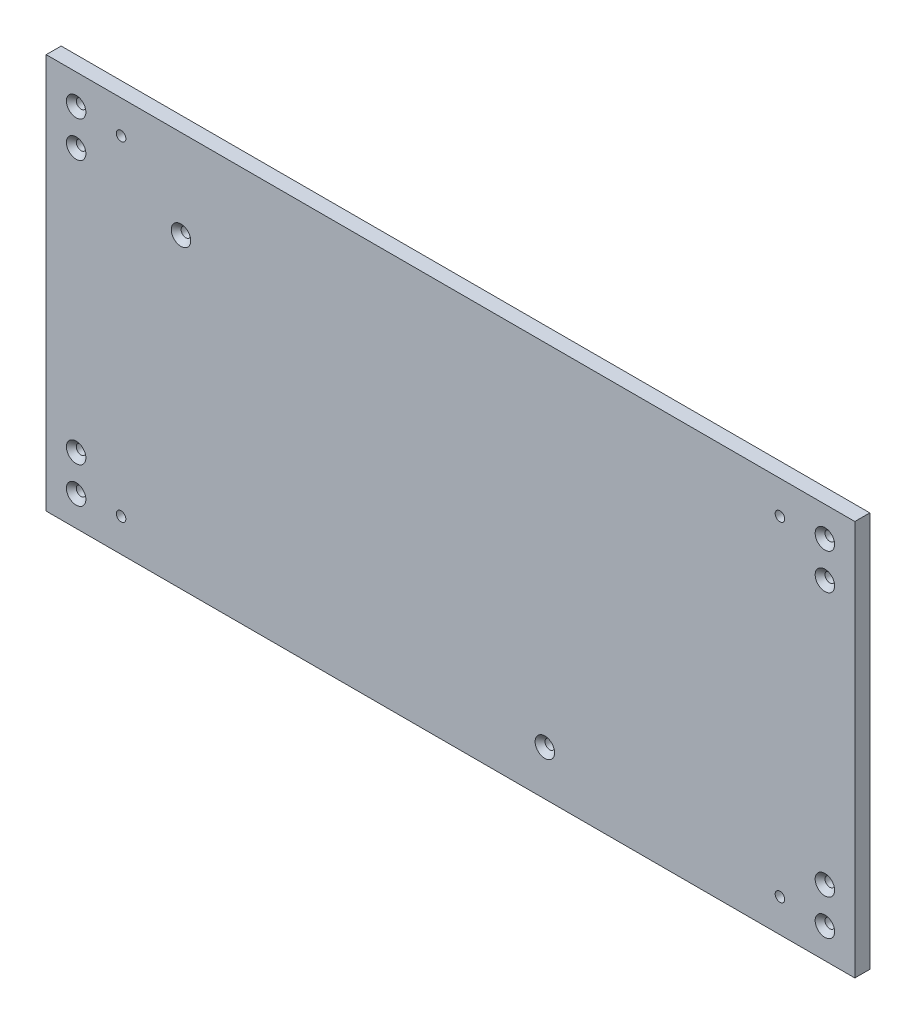
from build123d import *

# Parameters (mm, degrees)
SKETCH1_W                            = 270
SKETCH1_H                            = 132
BASE_DEPTH                           = 2.5
F_3_2_3_2_WALLMOUNTHOLES_D           = 3.2
F_3_2_3_2_WALLMOUNTHOLES_CSINK_D     = 6.5
F_3_2_3_2_WALLMOUNTHOLES_CSINK_ANGLE = 90
F_3_2_3_2_FEETMOUNTHOLES_D           = 3.2
F_3_2_3_2_DIAMETER_HOLE2_D           = 3.2
F_3_2_3_2_DIAMETER_HOLE2_CSINK_D     = 6.5
F_3_2_3_2_DIAMETER_HOLE2_CSINK_ANGLE = 90


with BuildPart() as part:
    # Sketch1 → Base (new, symmetric)
    with BuildSketch(Plane.XY):
        Rectangle(SKETCH1_W, SKETCH1_H)
    extrude(amount=BASE_DEPTH, both=True)

    # Ø3.2 (3.2) WallMountHoles (through all)
    with Locations(Plane.XY.offset(2.5)):
        with Locations((-125, 56), (-125, 44), (-125, -44), (-125, -56), (125, -56), (125, -44), (125, 44), (125, 56)):
            CounterSinkHole(F_3_2_3_2_WALLMOUNTHOLES_D / 2, F_3_2_3_2_WALLMOUNTHOLES_CSINK_D / 2, counter_sink_angle=F_3_2_3_2_WALLMOUNTHOLES_CSINK_ANGLE)

    # Ø3.2 (3.2) FeetMountHoles (through all)
    with Locations(Plane.XY.offset(2.5)):
        with Locations((110, 55), (-110, 55), (-110, -55), (110, -55)):
            Hole(F_3_2_3_2_FEETMOUNTHOLES_D / 2)

    # Ø3.2 (3.2) Diameter Hole2 (through all)
    with Locations(Plane.XY.offset(2.5)):
        with Locations((31.5, -51), (-90, 36.3)):
            CounterSinkHole(F_3_2_3_2_DIAMETER_HOLE2_D / 2, F_3_2_3_2_DIAMETER_HOLE2_CSINK_D / 2, counter_sink_angle=F_3_2_3_2_DIAMETER_HOLE2_CSINK_ANGLE)


solid = part.part
